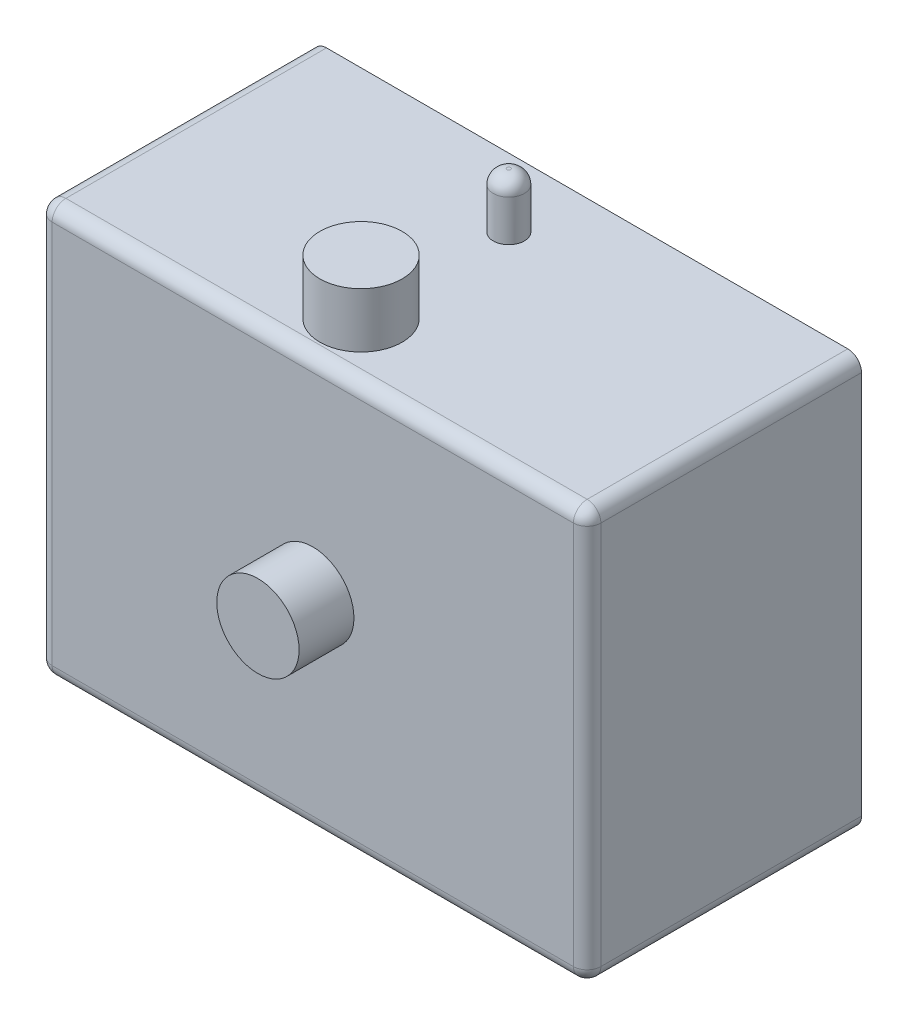
from build123d import *

# Parameters (mm, degrees)
SKETCH_1_W          = 200
SKETCH_1_H          = 150
EXTRUDE_1_DEPTH     = 100
SKETCH_3_R          = 15
EXTRUDE_2_DEPTH     = 20
SHELL_7_T           = -10
SKETCH_5_R          = 15
EXTRUDE_5_DEPTH     = 20
SKETCH_4_R          = 10
EXTRUDE_6_DEPTH     = 50
SKETCH_7_3_R        = 5.677909162
EXTRUDE_7_DEPTH     = 20
FILLET_2_R          = 5
FILLET_3_R          = 5
CUT_EXTRUDE_4_DEPTH = 20


with BuildPart() as part:
    # 草图1 → 凸台-拉伸1 (new body)
    with BuildSketch(Plane.XY):
        Rectangle(SKETCH_1_W, SKETCH_1_H)
    extrude(amount=EXTRUDE_1_DEPTH)

    # 抽壳7
    shell_7_openings = [part.faces().sort_by_distance(p)[0] for p in [
        (0, 0, 0),
    ]]
    offset(amount=SHELL_7_T, openings=shell_7_openings, kind=Kind.INTERSECTION)

    # 草图5 → 凸台-拉伸5 (add)
    with BuildSketch(Plane.XY.offset(100)):
        Circle(SKETCH_5_R)
    extrude(amount=EXTRUDE_5_DEPTH)

    # 草图4 → 凸台-拉伸6 (add)
    with BuildSketch(Plane(origin=(0, -65, 0), x_dir=(1, 0, 0), z_dir=(0, 1, 0))):
        with Locations(Location((-3.651940705, -24.892907654, 0), (0, 0, 270))):
            Circle(SKETCH_4_R)
    extrude(amount=EXTRUDE_6_DEPTH)

    # 放样2: read off the stored shape, not the designer's step
    # 放样2: loft between two sections, ruled curve by curve
    loft_2_from = [
        Edge.make_bspline([(-6.42374571, -15, 15.284729002), (-25.640103015, -15, 20.828339012), (-20.096493004, -15, 40.044696317), (-0.8801357, -15, 34.501086306), (18.336221605, -15, 28.957476296), (12.792611594, -15, 9.741118991), (-6.42374571, -15, 15.284729002)], [0, 0, 0, 0, 0.5, 0.5, 0.5, 1, 1, 1, 1], 3, [1, 0.333333333, 0.333333333, 1, 0.333333333, 0.333333333, 1]),
    ]
    loft_2_to = [
        Edge.make_bspline([(-3.812458415, 75, 19.217267909), (-15.163737905, 75, 19.538303329), (-14.842702485, 75, 30.889582819), (-3.491422995, 75, 30.568547399), (7.859856496, 75, 30.247511979), (7.538821075, 75, 18.896232489), (-3.812458415, 75, 19.217267909)], [0, 0, 0, 0, 0.5, 0.5, 0.5, 1, 1, 1, 1], 3, [1, 0.333333333, 0.333333333, 1, 0.333333333, 0.333333333, 1]),
    ]
    loft_2 = Solid(Shell([*[Face.make_surface_from_curves(loft_2_from[k], loft_2_to[k]) for k in range(1)], Face(Wire(loft_2_from)), Face(Wire(loft_2_to))]))
    add(loft_2)

    # 草图7<3> → 凸台-拉伸7 (add)
    with BuildSketch(Plane(origin=(0, 75, 0), x_dir=(1, 0, 0), z_dir=(0, 1, 0))):
        with Locations(Location((-3.651940705, -24.892907654, 0), (0, 0, 90))):
            Circle(SKETCH_7_3_R)
    extrude(amount=EXTRUDE_7_DEPTH)

    # 圆角2
    fillet_2_edges = [part.edges().sort_by_distance(p)[0] for p in [
        (-3.651940705, 95, 30.570816816),
    ]]
    fillet(fillet_2_edges, radius=FILLET_2_R)

    # 圆角3
    fillet_3_edges = [part.edges().sort_by_distance(p)[0] for p in [
        (-100, 0, 100),
        (0, -75, 100),
        (100, 0, 100),
        (100, -75, 50),
        (-100, -75, 50),
        (-100, 75, 50),
        (100, 75, 50),
        (0, 75, 100),
    ]]
    fillet(fillet_3_edges, radius=FILLET_3_R)

    # 草图8 → 切除-拉伸4 (cut)
    with BuildSketch(Plane(origin=(0, -65, 0), x_dir=(1, 0, 0), z_dir=(0, 1, 0))):
        with BuildLine():
            Line((63.543768265, -4.034008698), (76.142963697, -4.034008698))
            ThreePointArc((76.142963697, -4.034008698), (80.342695507, -8.233740508), (76.142963697, -12.433472319))
            Line((76.142963697, -12.433472319), (63.543768265, -12.433472319))
            ThreePointArc((63.543768265, -12.433472319), (59.344036454, -8.233740508), (63.543768265, -4.034008698))
        make_face()
    extrude(amount=-CUT_EXTRUDE_4_DEPTH, mode=Mode.SUBTRACT)


with BuildPart() as body_2:
    # 草图3 → 凸台-拉伸2 (new body)
    with BuildSketch(Plane(origin=(0, 75, 0), x_dir=(1, 0, 0), z_dir=(0, 1, 0))):
        with Locations(Location((-3.286746634, -79.124227121, 0), (0, 0, 270))):
            Circle(SKETCH_3_R)
    extrude(amount=EXTRUDE_2_DEPTH)


solid = Compound([part.part, body_2.part])
